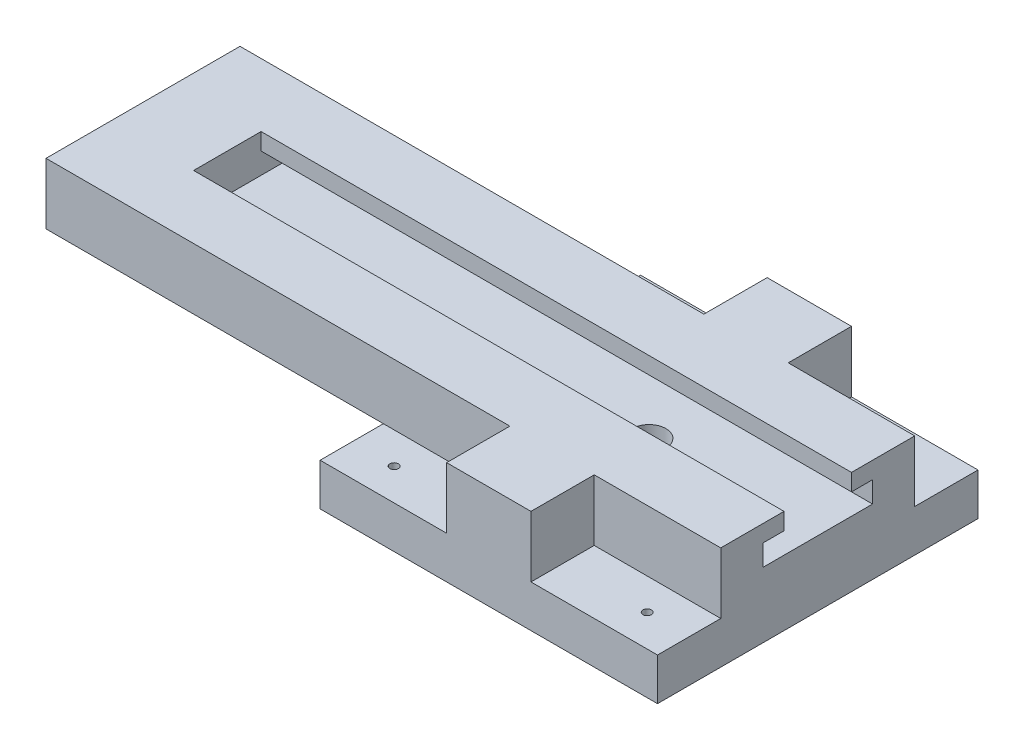
from build123d import *

# Parameters (mm, degrees)
BOSS_EXTRUDE1_DEPTH = 4
BOSS_EXTRUDE2_DEPTH = 5
BOSS_EXTRUDE3_START = -5
SKETCH3_W           = 160
SKETCH3_H           = 76
BOSS_EXTRUDE3_DEPTH = 5.5
BOSS_EXTRUDE4_START = -10.5
SKETCH4_W           = 80
SKETCH4_H           = 76
BOSS_EXTRUDE4_DEPTH = 10
BOSS_EXTRUDE7_START = -20.5
SKETCH17_R          = 19
BOSS_EXTRUDE7_DEPTH = 8
CUT_EXTRUDE1_START  = -25
SKETCH5_R           = 10.5
CUT_EXTRUDE1_DEPTH  = 12
CUT_EXTRUDE2_START  = -4
SKETCH7_R           = 1.5
CUT_EXTRUDE2_DEPTH  = 25
CUT_EXTRUDE3_START  = -5
SKETCH8_R           = 4
CUT_EXTRUDE3_DEPTH  = 18.5
CUT_EXTRUDE5_START  = 4
SKETCH18_W          = 110
SKETCH18_H          = 15
SKETCH18_W_2        = 30
CUT_EXTRUDE5_DEPTH  = 14.5
CUT_EXTRUDE6_START  = 4
SKETCH9_R           = 1
CUT_EXTRUDE6_DEPTH  = 40


with BuildPart() as part:
    # Sketch1 → Boss-Extrude1 (new body)
    with BuildSketch(Plane(origin=(0, 0, 0), x_dir=(1, 0, 0), z_dir=(0, 1, 0))):
        Polygon((80, -16), (220, -16), (220, -46), (60, -46), (60, 30), (220, 30), (220, 0), (80, 0), align=None)
    extrude(amount=BOSS_EXTRUDE1_DEPTH)

    # Sketch2 → Boss-Extrude2 (add)
    with BuildSketch(Plane(origin=(0, 0, 0), x_dir=(1, 0, 0), z_dir=(0, 1, 0))):
        Polygon((220, 5), (220, 30), (60, 30), (60, -46), (220, -46), (220, -21), (80, -21), (80, 5), align=None)
    extrude(amount=-BOSS_EXTRUDE2_DEPTH)

    # Sketch3 → Boss-Extrude3 (add)
    with BuildSketch(Plane(origin=(0, 0, 0), x_dir=(1, 0, 0), z_dir=(0, 1, 0)).offset(BOSS_EXTRUDE3_START)):
        with Locations((140, -8)):
            Rectangle(SKETCH3_W, SKETCH3_H)
    extrude(amount=-BOSS_EXTRUDE3_DEPTH)

    # Sketch4 → Boss-Extrude4 (add)
    with BuildSketch(Plane(origin=(0, 0, 0), x_dir=(1, 0, 0), z_dir=(0, 1, 0)).offset(BOSS_EXTRUDE4_START)):
        with Locations((180, -8)):
            Rectangle(SKETCH4_W, SKETCH4_H)
    extrude(amount=-BOSS_EXTRUDE4_DEPTH)

    # Sketch17 → Boss-Extrude7 (add)
    with BuildSketch(Plane(origin=(0, 0, 0), x_dir=(1, 0, 0), z_dir=(0, 1, 0)).offset(BOSS_EXTRUDE7_START)):
        with Locations((180, -8)):
            Circle(SKETCH17_R)
    extrude(amount=-BOSS_EXTRUDE7_DEPTH)

    # Sketch5 → Cut-Extrude1 (cut)
    with BuildSketch(Plane(origin=(0, 0, 0), x_dir=(1, 0, 0), z_dir=(0, 1, 0)).offset(CUT_EXTRUDE1_START)):
        with Locations((180, -8)):
            Circle(SKETCH5_R)
    extrude(amount=-CUT_EXTRUDE1_DEPTH, mode=Mode.SUBTRACT)

    # Sketch7 → Cut-Extrude2 (cut)
    with BuildSketch(Plane(origin=(0, 0, 0), x_dir=(1, 0, 0), z_dir=(0, 1, 0)).offset(CUT_EXTRUDE2_START)):
        with Locations((180, -8)):
            Circle(SKETCH7_R)
    extrude(amount=-CUT_EXTRUDE2_DEPTH, mode=Mode.SUBTRACT)

    # Sketch8 → Cut-Extrude3 (cut)
    with BuildSketch(Plane(origin=(0, 0, 0), x_dir=(1, 0, 0), z_dir=(0, 1, 0)).offset(CUT_EXTRUDE3_START)):
        with Locations((180, -8)):
            Circle(SKETCH8_R)
    extrude(amount=-CUT_EXTRUDE3_DEPTH, mode=Mode.SUBTRACT)

    # Sketch18 → Cut-Extrude5 (cut)
    with BuildSketch(Plane(origin=(0, 0, 0), x_dir=(1, 0, 0), z_dir=(0, 1, 0)).offset(CUT_EXTRUDE5_START)):
        with Locations((115, 22.5)):
            Rectangle(SKETCH18_W, SKETCH18_H)
        with Locations((115, -38.5)):
            Rectangle(SKETCH18_W, SKETCH18_H)
        with Locations((205, 22.5)):
            Rectangle(SKETCH18_W_2, SKETCH18_H)
        with Locations((205, -38.5)):
            Rectangle(SKETCH18_W_2, SKETCH18_H)
    extrude(amount=-CUT_EXTRUDE5_DEPTH, mode=Mode.SUBTRACT)

    # Sketch9 → Cut-Extrude6 (cut)
    with BuildSketch(Plane(origin=(0, 0, 0), x_dir=(1, 0, 0), z_dir=(0, 1, 0)).offset(CUT_EXTRUDE6_START)):
        with Locations((150, 22.45)):
            Circle(SKETCH9_R)
        with Locations((150, -38.45)):
            Circle(SKETCH9_R)
        with Locations((210, 22.45)):
            Circle(SKETCH9_R)
        with Locations((210, -38.45)):
            Circle(SKETCH9_R)
    extrude(amount=-CUT_EXTRUDE6_DEPTH, mode=Mode.SUBTRACT)


solid = part.part
